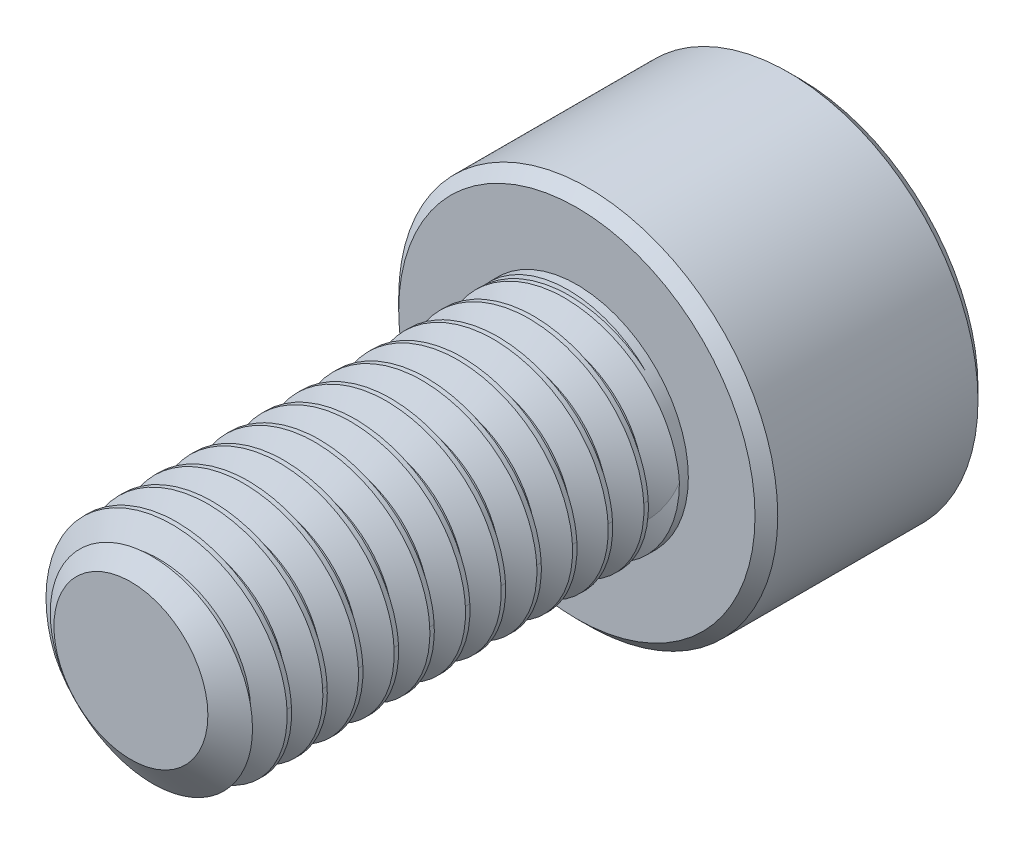
from build123d import *

# Parameters (mm, degrees)
SKETCH1_R          = 2.5
EXTRUDE1_DEPTH     = 10
CUT_SWEEP1_PITCH   = 0.8
SKETCH6_R          = 4.25
EXTRUDE2_DEPTH     = 5
CUT_EXTRUDE1_DEPTH = 3
CHAMFER1_SIZE      = 0.255


with BuildPart() as part:
    # Sketch1 → Extrude1 (new body)
    with BuildSketch(Plane.XY):
        Circle(SKETCH1_R)
    extrude(amount=-EXTRUDE1_DEPTH)

    # Cut-Sweep1: the profile of Sketch3 profile screwed along a right-hand helix of 13.5 turns, 6 arcs to a turn; built about Z, then put on its axis
    cut_sweep1_z = Axis((0, 0, 0), (0, 0, 1))
    cut_sweep1_corners = [(2.5003, 0, -0.700173205), (1.980384758, 0, -0.4), (1.980384758, 0, -0.3), (2.5003, 0, 0.000173205)]
    with BuildLine(mode=Mode.PRIVATE) as cut_sweep1_profile:
        Line(cut_sweep1_corners[0], cut_sweep1_corners[1])
        Line(cut_sweep1_corners[1], cut_sweep1_corners[2])
        Line(cut_sweep1_corners[2], cut_sweep1_corners[3])
        Line(cut_sweep1_corners[3], cut_sweep1_corners[0])
    cut_sweep1_cap = Face(cut_sweep1_profile.wire())
    cut_sweep1_turn_angles = [0, 30, 60, 90, 120, 150, 180, 210, 240, 270, 300, 330, 360]
    cut_sweep1_turn_weights = [1, 0.8660254037844387, 1, 0.8660254037844387, 1, 0.8660254037844387, 1, 0.8660254037844387, 1, 0.8660254037844387, 1, 0.8660254037844387, 1]
    cut_sweep1_turn_rails = [Edge.make_bspline([Vector(p[0], p[1], 0).rotate(cut_sweep1_z, cut_sweep1_turn_angles[k]) / cut_sweep1_turn_weights[k] + Vector(0, 0, p[2] + CUT_SWEEP1_PITCH * cut_sweep1_turn_angles[k] / 360) for k in range(13)], [0, 0, 0, 1, 1, 2, 2, 3, 3, 4, 4, 5, 5, 6, 6, 6], 2, cut_sweep1_turn_weights) for p in cut_sweep1_corners]
    cut_sweep1_turn_sides = [Face.make_surface_from_curves(cut_sweep1_turn_rails[p[0]], cut_sweep1_turn_rails[p[1]]) for p in [(0, 1), (1, 2), (2, 3), (3, 0)]]
    cut_sweep1_last_angles = [4680, 4710, 4740, 4770, 4800, 4830, 4860]
    cut_sweep1_last_weights = [1, 0.8660254037844387, 1, 0.8660254037844387, 1, 0.8660254037843435, 1]
    cut_sweep1_last_rails = [Edge.make_bspline([Vector(p[0], p[1], 0).rotate(cut_sweep1_z, cut_sweep1_last_angles[k]) / cut_sweep1_last_weights[k] + Vector(0, 0, p[2] + CUT_SWEEP1_PITCH * cut_sweep1_last_angles[k] / 360) for k in range(7)], [0, 0, 0, 1, 1, 2, 2, 3, 3, 3], 2, cut_sweep1_last_weights) for p in cut_sweep1_corners]
    cut_sweep1_last_sides = [Face.make_surface_from_curves(cut_sweep1_last_rails[p[0]], cut_sweep1_last_rails[p[1]]) for p in [(0, 1), (1, 2), (2, 3), (3, 0)]]
    cut_sweep1 = Plane(origin=(0, 0, 0), x_dir=(0, 1, 0), z_dir=(0, 0, -1)) * Solid(Shell([*[p.moved(Location((0, 0, CUT_SWEEP1_PITCH * i))) for i in range(13) for p in cut_sweep1_turn_sides], *cut_sweep1_last_sides, cut_sweep1_cap, cut_sweep1_cap.rotate(cut_sweep1_z, 4860).moved(Location((0, 0, CUT_SWEEP1_PITCH * 4860 / 360)))]))
    add(cut_sweep1, mode=Mode.SUBTRACT)

    # Sketch4 → Cut-Revolve1 (revolve, cut)
    with BuildSketch(Plane(origin=(0, 0, 0), x_dir=(0, 0, -1), z_dir=(1, 0, 0)), mode=Mode.PRIVATE) as cut_revolve1_sk:
        Polygon((0.541691224, 2.5), (0, 1.726384758), (0, 2.5), align=None)
    revolve(cut_revolve1_sk.sketch.rotate(Axis((0, 0, 0), (0, 0, -1)), 260.43858876), axis=Axis((0, 0, 0), (0, 0, -1)), mode=Mode.SUBTRACT)

    # Sketch6 → Extrude2 (add)
    with BuildSketch(Plane(origin=(0, 0, -10), x_dir=(-1, 0, 0), z_dir=(0, 0, -1))):
        Circle(SKETCH6_R)
    extrude(amount=EXTRUDE2_DEPTH)

    # Sketch7 → Cut-Extrude1 (cut)
    with BuildSketch(Plane(origin=(0, 0, -15), x_dir=(-1, 0, 0), z_dir=(0, 0, -1))):
        Polygon((0, 2.309401077), (-2, 1.154700538), (-2, -1.154700538), (0, -2.309401077), (2, -1.154700538), (2, 1.154700538), align=None)
    extrude(amount=-CUT_EXTRUDE1_DEPTH, mode=Mode.SUBTRACT)

    # Cut-Extrude2 cone 1 section (through the dimple's axis) → Cut-Extrude2 (revolve, cut)
    with BuildSketch(Plane(origin=(0, 0, -15), x_dir=(0, 1, 0), z_dir=(1, 0, 0))):
        Polygon((0, 0), (2.309401077, 0), (0, 2.309401077), align=None)
    revolve(axis=Axis((0, 0, -15), (0, 0, 1)), mode=Mode.SUBTRACT)

    # Chamfer1
    chamfer1_edges = [part.edges().sort_by_distance(p)[0] for p in [
        (4.25, 0, -10),
        (4.25, 0, -15),
    ]]
    chamfer(chamfer1_edges, length=CHAMFER1_SIZE)

    # Sketch10 → Revolve1 (revolve)
    with BuildSketch(Plane(origin=(0, 0, 0), x_dir=(0, 0, -1), z_dir=(1, 0, 0)), mode=Mode.PRIVATE) as revolve1_sk:
        Polygon((10, 2.5), (10, 0), (8.764466094, 0), (9.8, 2.5), align=None)
    revolve(revolve1_sk.sketch.rotate(Axis((0, 0, -10), (0, 0, 1)), 270), axis=Axis((0, 0, -10), (0, 0, 1)))


solid = part.part
